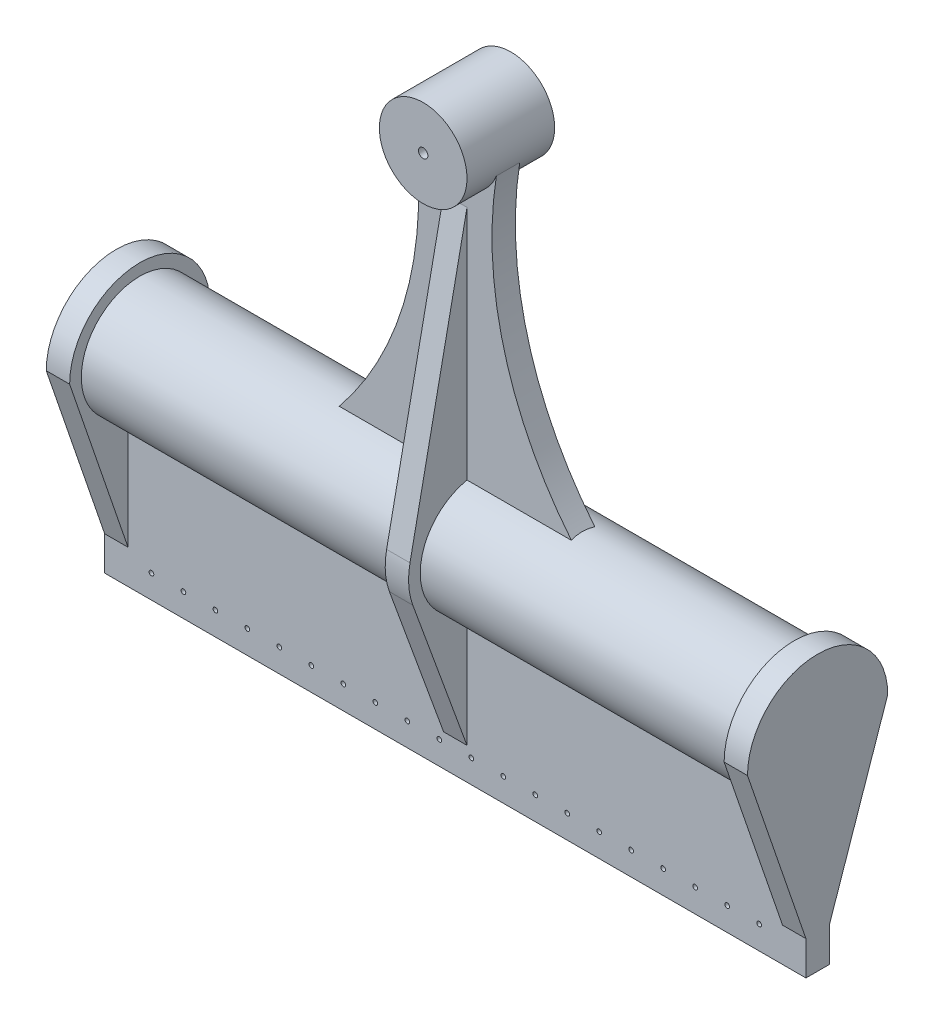
from build123d import *

# Parameters (mm, degrees)
COEFFICIENTS_PLATE_DEPTH      = 2.54
COEFFICIENTS_PLATE_DEPTH_BACK = 2.54
COEFFICIENTS_PLATE_SKETCH_W   = 44.45
COEFFICIENTS_PLATE_SKETCH_H   = 152.4
COEFFICIENTS_PLATE_SKETCH_R   = 0.508
PIVOT_CYLINDER_DEPTH          = 76.2
PIVOT_CYLINDER_DEPTH_BACK     = 76.2
PIVOT_CYLINDER_SKETCH_R       = 12.7
EDGE_START                    = 71.12
EDGE_RIB_FRONT_DEPTH          = 5.08
EDGE_START_2                  = -76.2
EDGE_RIB_BACK_DEPTH           = 5.08
SUMMATION_PLATE_DEPTH         = 2.54
SUMMATION_PLATE_DEPTH_BACK    = 2.54
SUMMATION_ANCHOR_DEPTH        = 9.525
SUMMATION_ANCHOR_DEPTH_BACK   = 9.525
SUMMATION_ANCHOR_SKETCH_R     = 9.525
SUMMATION_ANCHOR_SKETCH_R_2   = 1.016
MIDDLE_RIB_DEPTH              = 2.54
MIDDLE_RIB_DEPTH_BACK         = 2.54


with BuildPart() as part:
    # Coefficients Plate Sketch → Coefficients Plate (new, two sides: drawn at the far end of the back side and taken through both)
    with BuildSketch(Plane(origin=(0, 0, 0), x_dir=(0, 1, 0), z_dir=(0, 0, 1)).offset(-COEFFICIENTS_PLATE_DEPTH_BACK)):
        with Locations((-22.225, 0)):
            Rectangle(COEFFICIENTS_PLATE_SKETCH_W, COEFFICIENTS_PLATE_SKETCH_H)
        with Locations((-39.37, -66.04)):
            Circle(COEFFICIENTS_PLATE_SKETCH_R, mode=Mode.SUBTRACT)
        with Locations((-39.37, -59.088421053)):
            Circle(COEFFICIENTS_PLATE_SKETCH_R, mode=Mode.SUBTRACT)
        with Locations((-39.37, -52.136842105)):
            Circle(COEFFICIENTS_PLATE_SKETCH_R, mode=Mode.SUBTRACT)
        with Locations((-39.37, -45.185263158)):
            Circle(COEFFICIENTS_PLATE_SKETCH_R, mode=Mode.SUBTRACT)
        with Locations((-39.37, -38.233684211)):
            Circle(COEFFICIENTS_PLATE_SKETCH_R, mode=Mode.SUBTRACT)
        with Locations((-39.37, -31.282105263)):
            Circle(COEFFICIENTS_PLATE_SKETCH_R, mode=Mode.SUBTRACT)
        with Locations((-39.37, -24.330526316)):
            Circle(COEFFICIENTS_PLATE_SKETCH_R, mode=Mode.SUBTRACT)
        with Locations((-39.37, -17.378947368)):
            Circle(COEFFICIENTS_PLATE_SKETCH_R, mode=Mode.SUBTRACT)
        with Locations((-39.37, -10.427368421)):
            Circle(COEFFICIENTS_PLATE_SKETCH_R, mode=Mode.SUBTRACT)
        with Locations((-39.37, -3.475789474)):
            Circle(COEFFICIENTS_PLATE_SKETCH_R, mode=Mode.SUBTRACT)
        with Locations((-39.37, 3.475789474)):
            Circle(COEFFICIENTS_PLATE_SKETCH_R, mode=Mode.SUBTRACT)
        with Locations((-39.37, 10.427368421)):
            Circle(COEFFICIENTS_PLATE_SKETCH_R, mode=Mode.SUBTRACT)
        with Locations((-39.37, 17.378947368)):
            Circle(COEFFICIENTS_PLATE_SKETCH_R, mode=Mode.SUBTRACT)
        with Locations((-39.37, 24.330526316)):
            Circle(COEFFICIENTS_PLATE_SKETCH_R, mode=Mode.SUBTRACT)
        with Locations((-39.37, 31.282105263)):
            Circle(COEFFICIENTS_PLATE_SKETCH_R, mode=Mode.SUBTRACT)
        with Locations((-39.37, 38.233684211)):
            Circle(COEFFICIENTS_PLATE_SKETCH_R, mode=Mode.SUBTRACT)
        with Locations((-39.37, 45.185263158)):
            Circle(COEFFICIENTS_PLATE_SKETCH_R, mode=Mode.SUBTRACT)
        with Locations((-39.37, 52.136842105)):
            Circle(COEFFICIENTS_PLATE_SKETCH_R, mode=Mode.SUBTRACT)
        with Locations((-39.37, 59.088421053)):
            Circle(COEFFICIENTS_PLATE_SKETCH_R, mode=Mode.SUBTRACT)
        with Locations((-39.37, 66.04)):
            Circle(COEFFICIENTS_PLATE_SKETCH_R, mode=Mode.SUBTRACT)
    extrude(amount=COEFFICIENTS_PLATE_DEPTH + COEFFICIENTS_PLATE_DEPTH_BACK)

    # Pivot Cylinder Sketch → Pivot Cylinder (add, two sides: drawn at the far end of the back side and taken through both)
    with BuildSketch(Plane.YZ.offset(-PIVOT_CYLINDER_DEPTH_BACK)):
        Circle(PIVOT_CYLINDER_SKETCH_R)
    extrude(amount=PIVOT_CYLINDER_DEPTH + PIVOT_CYLINDER_DEPTH_BACK)

    # Edge Rib Front Sketch → Edge Rib Front (add)
    with BuildSketch(Plane.YZ.offset(EDGE_START)):
        with BuildLine():
            Line((0, 15.24), (-44.45, 0))
            Line((-44.45, 0), (0, -15.24))
            ThreePointArc((0, -15.24), (15.24, 0), (0, 15.24))
        make_face()
    extrude(amount=EDGE_RIB_FRONT_DEPTH)

    # Edge Rib Back Sketch → Edge Rib Back (add)
    with BuildSketch(Plane.YZ.offset(EDGE_START_2)):
        with BuildLine():
            Line((0, 15.24), (-44.45, 0))
            Line((-44.45, 0), (0, -15.24))
            ThreePointArc((0, -15.24), (15.24, 0), (0, 15.24))
        make_face()
    extrude(amount=EDGE_RIB_BACK_DEPTH)

    # Summation Plate Sketch → Summation Plate (add, two sides: drawn at the far end of the back side and taken through both)
    with BuildSketch(Plane(origin=(0, 0, 0), x_dir=(0, 1, 0), z_dir=(0, 0, 1)).offset(-SUMMATION_PLATE_DEPTH_BACK)):
        with BuildLine():
            Line((0, -38.1), (0, 38.1))
            ThreePointArc((0, 38.1), (33.985630195, 12.840847186), (76.2, 9.525))
            Line((76.2, 9.525), (76.2, -9.525))
            ThreePointArc((76.2, -9.525), (33.985630195, -12.840847186), (0, -38.1))
        make_face()
    extrude(amount=SUMMATION_PLATE_DEPTH + SUMMATION_PLATE_DEPTH_BACK)

    # Summation Anchor Sketch → Summation Anchor (add, two sides: drawn at the far end of the back side and taken through both)
    with BuildSketch(Plane(origin=(0, 0, 0), x_dir=(0, 1, 0), z_dir=(0, 0, 1)).offset(-SUMMATION_ANCHOR_DEPTH_BACK)):
        with Locations((76.2, 0)):
            Circle(SUMMATION_ANCHOR_SKETCH_R)
        with Locations((76.2, 0)):
            Circle(SUMMATION_ANCHOR_SKETCH_R_2, mode=Mode.SUBTRACT)
    extrude(amount=SUMMATION_ANCHOR_DEPTH + SUMMATION_ANCHOR_DEPTH_BACK)

    # Middle Rib Sketch → Middle Rib (add, two sides: drawn at the far end of the back side and taken through both)
    with BuildSketch(Plane.YZ.offset(-MIDDLE_RIB_DEPTH_BACK)):
        with BuildLine():
            Line((-44.45, 0), (-5.225026376, 14.316255211))
            ThreePointArc((-5.225026376, 14.316255211), (-1.131177872, 15.197936065), (3.048089123, 14.93207128))
            Line((3.048089123, 14.93207128), (76.2, 0))
            Line((76.2, 0), (3.048089123, -14.93207128))
            ThreePointArc((3.048089123, -14.93207128), (-1.131177872, -15.197936065), (-5.225026376, -14.316255211))
            Line((-5.225026376, -14.316255211), (-44.45, 0))
        make_face()
    extrude(amount=MIDDLE_RIB_DEPTH + MIDDLE_RIB_DEPTH_BACK)


solid = part.part
